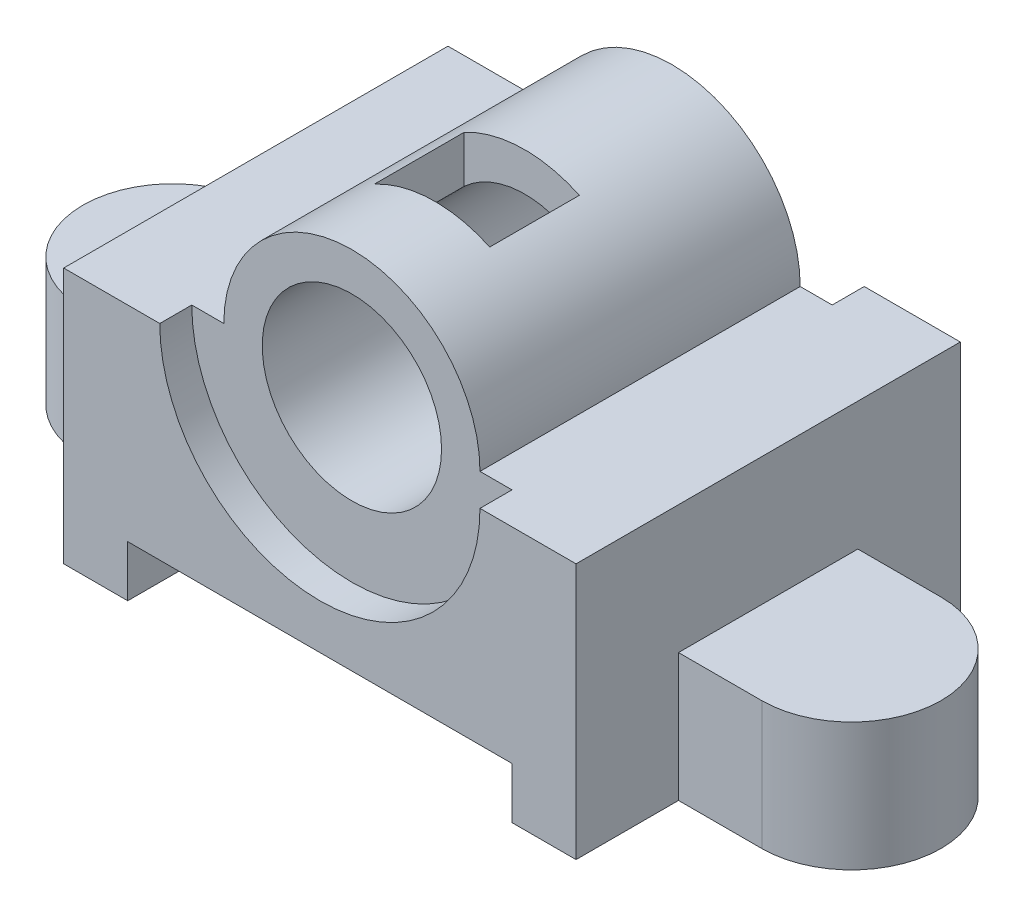
from build123d import *

# Parameters (mm, degrees)
SKETCH1_W           = 80
SKETCH1_H           = 40
BOSS_EXTRUDE1_DEPTH = 60
SKETCH2_W           = 60
SKETCH2_H           = 8
CUT_EXTRUDE1_DEPTH  = 60
SKETCH8_R           = 25
CUT_EXTRUDE4_DEPTH  = 5
CUT_EXTRUDE5_START  = -5
SKETCH11_R          = 25
CUT_EXTRUDE5_DEPTH  = 5
SKETCH12_R          = 20
BOSS_EXTRUDE3_DEPTH = 50
SKETCH13_R          = 14
CUT_EXTRUDE6_DEPTH  = 50
SKETCH16_W          = 17.998902401
SKETCH16_H          = 14
CUT_EXTRUDE7_DEPTH  = 50
BOSS_EXTRUDE6_DEPTH = 12
BOSS_EXTRUDE7_START = 8
BOSS_EXTRUDE7_DEPTH = 8


with BuildPart() as part:
    # Sketch1 → Boss-Extrude1 (new body)
    with BuildSketch(Plane.XY):
        with Locations((-2.735674677, 20)):
            Rectangle(SKETCH1_W, SKETCH1_H)
    extrude(amount=-BOSS_EXTRUDE1_DEPTH)

    # Sketch2 → Cut-Extrude1 (cut)
    with BuildSketch(Plane.XY):
        with Locations((-2.735674677, 4)):
            Rectangle(SKETCH2_W, SKETCH2_H)
    extrude(amount=-CUT_EXTRUDE1_DEPTH, mode=Mode.SUBTRACT)

    # Sketch8 → Cut-Extrude4 (cut)
    with BuildSketch(Plane.XY):
        with Locations((-2.735674677, 40)):
            Circle(SKETCH8_R)
    extrude(amount=-CUT_EXTRUDE4_DEPTH, mode=Mode.SUBTRACT)

    # Sketch11 → Cut-Extrude5 (cut)
    with BuildSketch(Plane(origin=(0, 0, -60), x_dir=(-1, 0, 0), z_dir=(0, 0, -1)).offset(CUT_EXTRUDE5_START)):
        with Locations((2.735674677, 40)):
            Circle(SKETCH11_R)
    extrude(amount=CUT_EXTRUDE5_DEPTH, mode=Mode.SUBTRACT)

    # Sketch12 → Boss-Extrude3 (add)
    with BuildSketch(Plane.XY.offset(-5)):
        with Locations((-2.735674677, 40)):
            Circle(SKETCH12_R)
    extrude(amount=-BOSS_EXTRUDE3_DEPTH)

    # Sketch13 → Cut-Extrude6 (cut)
    with BuildSketch(Plane.XY.offset(-5)):
        with Locations((-2.735674677, 40)):
            Circle(SKETCH13_R)
    extrude(amount=-CUT_EXTRUDE6_DEPTH, mode=Mode.SUBTRACT)

    # Sketch16 → Cut-Extrude7 (cut)
    with BuildSketch(Plane(origin=(0, 40, 0), x_dir=(1, 0, 0), z_dir=(0, 1, 0))):
        with Locations((-3.21436889, 25)):
            Rectangle(SKETCH16_W, SKETCH16_H)
    extrude(amount=CUT_EXTRUDE7_DEPTH, mode=Mode.SUBTRACT)

    # Sketch21 → Boss-Extrude6 (add)
    with BuildSketch(Plane.XZ.offset(-8)):
        with BuildLine():
            Line((50.264325323, -16), (37.264325323, -16))
            Line((37.264325323, -16), (37.264325323, -44))
            Line((37.264325323, -44), (50.264325323, -44))
            ThreePointArc((50.264325323, -44), (64.264325323, -30), (50.264325323, -16))
        make_face()
        with BuildLine():
            Line((-42.735674677, -44), (-42.735674677, -16))
            Line((-42.735674677, -16), (-55.735674677, -16))
            ThreePointArc((-55.735674677, -16), (-69.735674677, -30), (-55.735674677, -44))
            Line((-55.735674677, -44), (-42.735674677, -44))
        make_face()
    extrude(amount=-BOSS_EXTRUDE6_DEPTH)

    # Sketch22 → Boss-Extrude7 (add)
    with BuildSketch(Plane.XZ.offset(-8).offset(BOSS_EXTRUDE7_START)):
        with BuildLine():
            Line((-42.735674677, -44), (-42.735674677, -16))
            Line((-42.735674677, -16), (-55.735674677, -16))
            ThreePointArc((-55.735674677, -16), (-69.735674677, -30), (-55.735674677, -44))
            Line((-55.735674677, -44), (-42.735674677, -44))
        make_face()
        with BuildLine():
            Line((50.264325323, -16), (37.264325323, -16))
            Line((37.264325323, -16), (37.264325323, -44))
            Line((37.264325323, -44), (50.264325323, -44))
            ThreePointArc((50.264325323, -44), (64.264325323, -30), (50.264325323, -16))
        make_face()
    extrude(amount=-BOSS_EXTRUDE7_DEPTH)


solid = part.part
